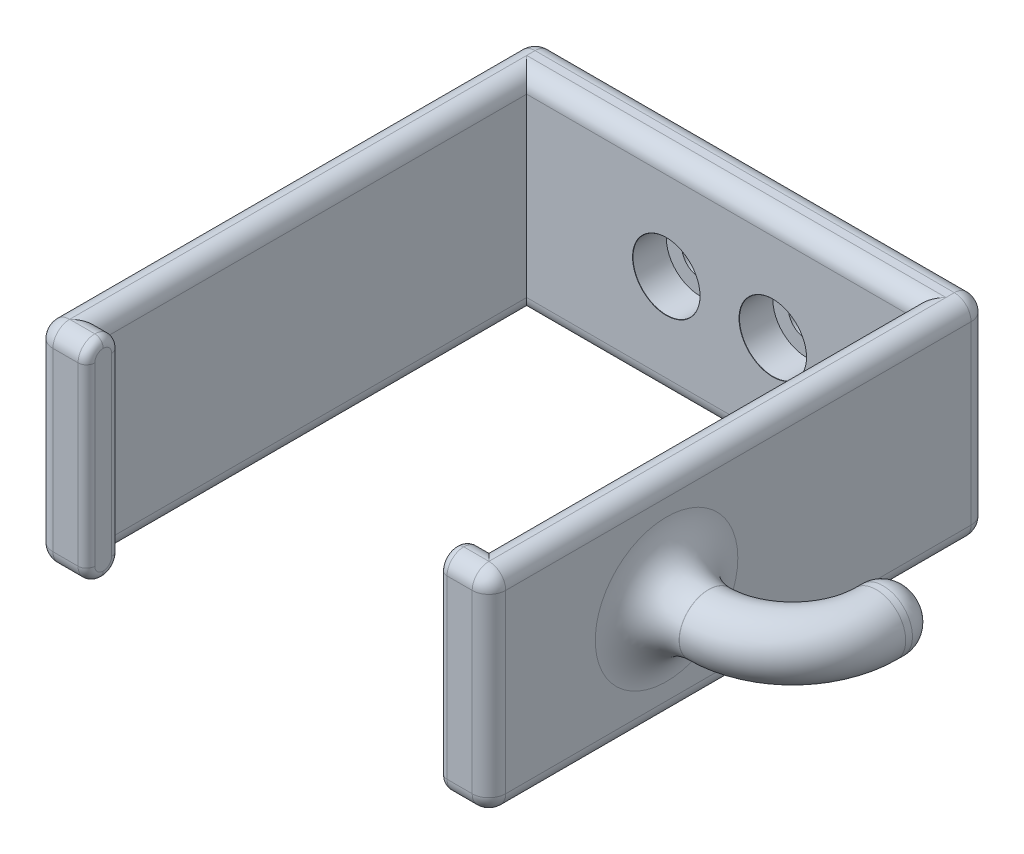
from build123d import *

# Parameters (mm, degrees)
BOSS_EXTRUDE1_DEPTH           = 25
FILLET1_R                     = 1
CBORE_FOR_M4_SHCS1_AT_2_COUNT = 2
CBORE_FOR_M4_SHCS1_AT_2_PITCH = 12.7
FILLET2_R                     = 2
SKETCH4_R                     = 3.5
FILLET3_R                     = 5
FILLET4_R                     = 3


with BuildPart() as part:
    # Sketch1 → Boss-Extrude1 (new body)
    with BuildSketch(Plane(origin=(0, 0, 0), x_dir=(1, 0, 0), z_dir=(0, 1, 0))):
        Polygon((18, -1.724489796), (18, -52.224489796), (16, -52.224489796), (16, -56.224489796), (18, -56.224489796), (22, -56.224489796), (22, 3.275510204), (-32, 3.275510204), (-32, -56.224489796), (-28, -56.224489796), (-26, -56.224489796), (-26, -52.224489796), (-28, -52.224489796), (-28, -1.724489796), align=None)
    extrude(amount=BOSS_EXTRUDE1_DEPTH)

    # Fillet1
    fillet1_edges = [part.edges().sort_by_distance(p)[0] for p in [
        (-26, 0, 54.224489796),
        (16, 0, 54.224489796),
        (16, 12.5, 52.224489796),
        (-26, 12.5, 52.224489796),
        (-26, 12.5, 56.224489796),
        (16, 12.5, 56.224489796),
        (-26, 25, 54.224489796),
        (16, 25, 54.224489796),
    ]]
    fillet(fillet1_edges, radius=FILLET1_R)

    # Sketch3 → CBORE for M4 SHCS1 (revolve, cut)
    with BuildSketch(Plane(origin=(1.35, 12.5, 1.724489796), x_dir=(0, -1, 0), z_dir=(1, 0, 0))):
        Polygon((0, 0), (0, 5), (2.15, 5), (2.15, 4), (4, 4), (4, 0.025), (4.025, 0), align=None)
    cbore_for_m4_shcs1 = revolve(axis=Axis((1.35, 12.5, 8.074489796), (0, 0, -1)), mode=Mode.SUBTRACT)

    # CBORE for M4 SHCS1 at 2: CBORE for M4 SHCS1 ×2
    with Locations(*[(-i * CBORE_FOR_M4_SHCS1_AT_2_PITCH, 0, 0) for i in range(1, CBORE_FOR_M4_SHCS1_AT_2_COUNT)]):
        add(cbore_for_m4_shcs1, mode=Mode.SUBTRACT)

    # Fillet2
    # the kernel refuses this fillet: 2 mm, written as the material it takes off along each edge
    with BuildSketch(Plane(origin=(16, 23, 54.224489796), x_dir=(0, 1, 0), z_dir=(0, 0, 1))) as fillet2_piece_1:
        with BuildLine():
            CenterArc((1, -1), 1, 0, 90)
            Line((2, -1), (2, 0))
            Line((2, 0), (1, 0))
        make_face()
    revolve(axis=Axis((16, 23, 54.224489796), (-1, 0, 0)), revolution_arc=90, mode=Mode.SUBTRACT)
    with BuildSketch(Plane(origin=(16, 23, 54.224489796), x_dir=(0, 0, 1), z_dir=(0, -1, 0))) as fillet2_piece_2:
        with BuildLine():
            CenterArc((1, -1), 1, 0, 90)
            Line((2, -1), (2, 0))
            Line((2, 0), (1, 0))
        make_face()
    revolve(axis=Axis((16, 23, 54.224489796), (-1, 0, 0)), revolution_arc=90, mode=Mode.SUBTRACT)
    with BuildSketch(Plane(origin=(-26, 23, 54.224489796), x_dir=(0, 1, 0), z_dir=(0, 0, -1))) as fillet2_piece_3:
        with BuildLine():
            CenterArc((1, -1), 1, 0, 90)
            Line((2, -1), (2, 0))
            Line((2, 0), (1, 0))
        make_face()
    revolve(axis=Axis((-26, 23, 54.224489796), (1, 0, 0)), revolution_arc=90, mode=Mode.SUBTRACT)
    with BuildSketch(Plane(origin=(-26, 23, 54.224489796), x_dir=(0, 0, -1), z_dir=(0, -1, 0))) as fillet2_piece_4:
        with BuildLine():
            CenterArc((1, -1), 1, 0, 90)
            Line((2, -1), (2, 0))
            Line((2, 0), (1, 0))
        make_face()
    revolve(axis=Axis((-26, 23, 54.224489796), (1, 0, 0)), revolution_arc=90, mode=Mode.SUBTRACT)
    with BuildSketch(Plane(origin=(16, 2, 54.224489796), x_dir=(0, -1, 0), z_dir=(0, 0, -1))) as fillet2_piece_5:
        with BuildLine():
            CenterArc((1, -1), 1, 0, 90)
            Line((2, -1), (2, 0))
            Line((2, 0), (1, 0))
        make_face()
    revolve(axis=Axis((16, 2, 54.224489796), (-1, 0, 0)), revolution_arc=90, mode=Mode.SUBTRACT)
    with BuildSketch(Plane(origin=(16, 2, 54.224489796), x_dir=(0, 0, -1), z_dir=(0, 1, 0))) as fillet2_piece_6:
        with BuildLine():
            CenterArc((1, -1), 1, 0, 90)
            Line((2, -1), (2, 0))
            Line((2, 0), (1, 0))
        make_face()
    revolve(axis=Axis((16, 2, 54.224489796), (-1, 0, 0)), revolution_arc=90, mode=Mode.SUBTRACT)
    with BuildSketch(Plane(origin=(-26, 2, 54.224489796), x_dir=(0, -1, 0), z_dir=(0, 0, 1))) as fillet2_piece_7:
        with BuildLine():
            CenterArc((1, -1), 1, 0, 90)
            Line((2, -1), (2, 0))
            Line((2, 0), (1, 0))
        make_face()
    revolve(axis=Axis((-26, 2, 54.224489796), (1, 0, 0)), revolution_arc=90, mode=Mode.SUBTRACT)
    with BuildSketch(Plane(origin=(-26, 2, 54.224489796), x_dir=(0, 0, 1), z_dir=(0, 1, 0))) as fillet2_piece_8:
        with BuildLine():
            CenterArc((1, -1), 1, 0, 90)
            Line((2, -1), (2, 0))
            Line((2, 0), (1, 0))
        make_face()
    revolve(axis=Axis((-26, 2, 54.224489796), (1, 0, 0)), revolution_arc=90, mode=Mode.SUBTRACT)
    with BuildSketch(Plane(origin=(20, 2, -1.275510204), x_dir=(0, -1, 0), z_dir=(0, 0, -1))) as fillet2_piece_9_section:
        Polygon((0, 0), (FILLET2_R, 0), (FILLET2_R, -FILLET2_R), (0, -FILLET2_R), align=None)
    fillet2_piece_9 = extrude(amount=FILLET2_R, mode=Mode.PRIVATE)
    fillet2_piece_9 = fillet2_piece_9 - Plane(origin=(20, 2, -1.275510204), x_dir=(-0.7071067811865475, 0.7071067811865475, 0), z_dir=(0, 0, -1)) * Sphere(FILLET2_R, mode=Mode.PRIVATE)
    add(fillet2_piece_9, mode=Mode.SUBTRACT)
    with BuildSketch(Plane(origin=(-30, 2, -1.275510204), x_dir=(-1, 0, 0), z_dir=(0, 0, -1))) as fillet2_piece_10_section:
        Polygon((0, 0), (FILLET2_R, 0), (FILLET2_R, -FILLET2_R), (0, -FILLET2_R), align=None)
    fillet2_piece_10 = extrude(amount=FILLET2_R, mode=Mode.PRIVATE)
    fillet2_piece_10 = fillet2_piece_10 - Plane(origin=(-30, 2, -1.275510204), x_dir=(0.7071067811865475, 0.7071067811865475, 0), z_dir=(0, 0, -1)) * Sphere(FILLET2_R, mode=Mode.PRIVATE)
    add(fillet2_piece_10, mode=Mode.SUBTRACT)
    with BuildSketch(Plane(origin=(-30, 2, 54.224489796), x_dir=(0, 0, 1), z_dir=(-1, 0, 0))) as fillet2_piece_11_section:
        Polygon((0, 0), (FILLET2_R, 0), (FILLET2_R, -FILLET2_R), (0, -FILLET2_R), align=None)
    fillet2_piece_11 = extrude(amount=FILLET2_R, mode=Mode.PRIVATE)
    fillet2_piece_11 = fillet2_piece_11 - Plane(origin=(-30, 2, 54.224489796), x_dir=(1.25607396694702e-15, 0.7071067811865475, -0.7071067811865475), z_dir=(-1, 0, 0)) * Sphere(FILLET2_R, mode=Mode.PRIVATE)
    add(fillet2_piece_11, mode=Mode.SUBTRACT)
    with BuildSketch(Plane(origin=(20, 2, 54.224489796), x_dir=(0, -1, 0), z_dir=(0, 0, 1))) as fillet2_piece_12_section:
        Polygon((0, 0), (FILLET2_R, 0), (FILLET2_R, FILLET2_R), (0, FILLET2_R), align=None)
    fillet2_piece_12 = extrude(amount=FILLET2_R, mode=Mode.PRIVATE)
    fillet2_piece_12 = fillet2_piece_12 - Plane(origin=(20, 2, 54.224489796), x_dir=(-0.7071067811865475, 0.7071067811865475, 0), z_dir=(0, 0, 1)) * Sphere(FILLET2_R, mode=Mode.PRIVATE)
    add(fillet2_piece_12, mode=Mode.SUBTRACT)
    with BuildSketch(Plane(origin=(-30, 23, 54.224489796), x_dir=(-1, 0, 0), z_dir=(0, 1, 0))) as fillet2_piece_13_section:
        Polygon((0, 0), (FILLET2_R, 0), (FILLET2_R, FILLET2_R), (0, FILLET2_R), align=None)
    fillet2_piece_13 = extrude(amount=FILLET2_R, mode=Mode.PRIVATE)
    fillet2_piece_13 = fillet2_piece_13 - Plane(origin=(-30, 23, 54.224489796), x_dir=(0.707106781186548, 0, -0.707106781186547), z_dir=(0, 1, 0)) * Sphere(FILLET2_R, mode=Mode.PRIVATE)
    add(fillet2_piece_13, mode=Mode.SUBTRACT)
    with BuildSketch(Plane(origin=(20, 23, -1.275510204), x_dir=(0, 0, -1), z_dir=(0, 1, 0))) as fillet2_piece_14_section:
        Polygon((0, 0), (FILLET2_R, 0), (FILLET2_R, -FILLET2_R), (0, -FILLET2_R), align=None)
    fillet2_piece_14 = extrude(amount=FILLET2_R, mode=Mode.PRIVATE)
    fillet2_piece_14 = fillet2_piece_14 - Plane(origin=(20, 23, -1.275510204), x_dir=(-0.7071067811865475, 0, 0.7071067811865477), z_dir=(0, 1, 0)) * Sphere(FILLET2_R, mode=Mode.PRIVATE)
    add(fillet2_piece_14, mode=Mode.SUBTRACT)
    with BuildSketch(Plane(origin=(-30, 23, -1.275510204), x_dir=(0, 0, -1), z_dir=(0, 1, 0))) as fillet2_piece_15_section:
        Polygon((0, 0), (FILLET2_R, 0), (FILLET2_R, FILLET2_R), (0, FILLET2_R), align=None)
    fillet2_piece_15 = extrude(amount=FILLET2_R, mode=Mode.PRIVATE)
    fillet2_piece_15 = fillet2_piece_15 - Plane(origin=(-30, 23, -1.275510204), x_dir=(0.7071067811865476, 0, 0.7071067811865475), z_dir=(0, 1, 0)) * Sphere(FILLET2_R, mode=Mode.PRIVATE)
    add(fillet2_piece_15, mode=Mode.SUBTRACT)
    with BuildSketch(Plane(origin=(20, 23, 54.224489796), x_dir=(0, 0, 1), z_dir=(0, 1, 0))) as fillet2_piece_16_section:
        Polygon((0, 0), (FILLET2_R, 0), (FILLET2_R, FILLET2_R), (0, FILLET2_R), align=None)
    fillet2_piece_16 = extrude(amount=FILLET2_R, mode=Mode.PRIVATE)
    fillet2_piece_16 = fillet2_piece_16 - Plane(origin=(20, 23, 54.224489796), x_dir=(-0.7071067811865464, 0, -0.7071067811865487), z_dir=(0, 1, 0)) * Sphere(FILLET2_R, mode=Mode.PRIVATE)
    add(fillet2_piece_16, mode=Mode.SUBTRACT)
    with BuildSketch(Plane(origin=(20, 0, -3.275510204), x_dir=(0, 1, 0), z_dir=(-1, 0, 0)), Plane(origin=(20, 25, -3.275510204), x_dir=(0, 0, 1), z_dir=(-1, 0, 0))) as fillet2_piece_17:
        with BuildLine():
            CenterArc((FILLET2_R, -FILLET2_R), FILLET2_R, 90, 90)
            Line((0, -FILLET2_R), (0, 0))
            Line((0, 0), (FILLET2_R, 0))
        make_face()
    extrude(amount=50, mode=Mode.SUBTRACT)
    with BuildSketch(Plane(origin=(-30, 0, 56.224489796), x_dir=(0, 1, 0), z_dir=(1, 0, 0)), Plane(origin=(16, 0, 56.224489796), x_dir=(0, 1, 0), z_dir=(1, 0, 0))) as fillet2_piece_18:
        with BuildLine():
            CenterArc((FILLET2_R, -FILLET2_R), FILLET2_R, 90, 90)
            Line((0, -FILLET2_R), (0, 0))
            Line((0, 0), (FILLET2_R, 0))
        make_face()
    extrude(amount=4, mode=Mode.SUBTRACT)
    with BuildSketch(Plane(origin=(-26, 0, 52.224489796), x_dir=(0, 1, 0), z_dir=(-1, 0, 0)), Plane(origin=(18, 0, 52.224489796), x_dir=(0, 1, 0), z_dir=(-1, 0, 0)), Plane(origin=(-26, 25, 52.224489796), x_dir=(0, 0, 1), z_dir=(-1, 0, 0)), Plane(origin=(18, 25, 52.224489796), x_dir=(0, 0, 1), z_dir=(-1, 0, 0))) as fillet2_piece_19:
        with BuildLine():
            CenterArc((FILLET2_R, -FILLET2_R), FILLET2_R, 90, 90)
            Line((0, -FILLET2_R), (0, 0))
            Line((0, 0), (FILLET2_R, 0))
        make_face()
    extrude(amount=2, mode=Mode.SUBTRACT)
    with BuildSketch(Plane(origin=(-28, 0, 52.224489796), x_dir=(0, 1, 0), z_dir=(0, 0, -1)), Plane(origin=(18, 0, 1.724489796), x_dir=(0, 1, 0), z_dir=(0, 0, 1)), Plane(origin=(18, 25, 1.724489796), x_dir=(1, 0, 0), z_dir=(0, 0, 1)), Plane(origin=(-28, 25, 52.224489796), x_dir=(-1, 0, 0), z_dir=(0, 0, -1))) as fillet2_piece_20:
        with BuildLine():
            CenterArc((FILLET2_R, -FILLET2_R), FILLET2_R, 90, 90)
            Line((0, -FILLET2_R), (0, 0))
            Line((0, 0), (FILLET2_R, 0))
        make_face()
    extrude(amount=50.5, mode=Mode.SUBTRACT)
    with BuildSketch(Plane(origin=(-28, 0, 1.724489796), x_dir=(0, 1, 0), z_dir=(1, 0, 0)), Plane(origin=(-28, 25, 1.724489796), x_dir=(0, 0, -1), z_dir=(1, 0, 0))) as fillet2_piece_21:
        with BuildLine():
            CenterArc((FILLET2_R, -FILLET2_R), FILLET2_R, 90, 90)
            Line((0, -FILLET2_R), (0, 0))
            Line((0, 0), (FILLET2_R, 0))
        make_face()
    extrude(amount=46, mode=Mode.SUBTRACT)
    with BuildSketch(Plane(origin=(-26, 25, 56.224489796), x_dir=(0, 0, -1), z_dir=(-1, 0, 0)), Plane(origin=(20, 25, 56.224489796), x_dir=(0, 0, -1), z_dir=(-1, 0, 0))) as fillet2_piece_22:
        with BuildLine():
            CenterArc((FILLET2_R, FILLET2_R), FILLET2_R, 180, 90)
            Line((0, FILLET2_R), (0, 0))
            Line((0, 0), (FILLET2_R, 0))
        make_face()
    extrude(amount=4, mode=Mode.SUBTRACT)
    with BuildSketch(Plane(origin=(-32, 2, -3.275510204), x_dir=(1, 0, 0), z_dir=(0, 1, 0)), Plane(origin=(-32, 2, 56.224489796), x_dir=(0, 0, -1), z_dir=(0, 1, 0)), Plane(origin=(22, 2, 56.224489796), x_dir=(-1, 0, 0), z_dir=(0, 1, 0)), Plane(origin=(22, 2, -3.275510204), x_dir=(0, 0, 1), z_dir=(0, 1, 0))) as fillet2_piece_23:
        with BuildLine():
            CenterArc((FILLET2_R, -FILLET2_R), FILLET2_R, 90, 90)
            Line((0, -FILLET2_R), (0, 0))
            Line((0, 0), (FILLET2_R, 0))
        make_face()
    extrude(amount=21, mode=Mode.SUBTRACT)
    with BuildSketch(Plane(origin=(-32, 25, -1.275510204), x_dir=(1, 0, 0), z_dir=(0, 0, 1)), Plane(origin=(-32, 0, -1.275510204), x_dir=(0, 1, 0), z_dir=(0, 0, 1)), Plane(origin=(22, 25, 54.224489796), x_dir=(-1, 0, 0), z_dir=(0, 0, -1)), Plane(origin=(22, 0, 54.224489796), x_dir=(0, 1, 0), z_dir=(0, 0, -1))) as fillet2_piece_24:
        with BuildLine():
            CenterArc((FILLET2_R, -FILLET2_R), FILLET2_R, 90, 90)
            Line((0, -FILLET2_R), (0, 0))
            Line((0, 0), (FILLET2_R, 0))
        make_face()
    extrude(amount=55.5, mode=Mode.SUBTRACT)
    with BuildSketch(Plane(origin=(-28, 0, 57.224489796), x_dir=(0, 1, 0), z_dir=(0, 0, -1))) as fillet2_piece_25a_section:
        with BuildLine():
            CenterArc((FILLET2_R, -FILLET2_R), FILLET2_R, 90, 90)
            Line((0, -FILLET2_R), (0, 0))
            Line((0, 0), (FILLET2_R, 0))
        make_face()
    fillet2_piece_25a = extrude(amount=55.5, mode=Mode.PRIVATE)
    fillet2_piece_25a = split(fillet2_piece_25a, bisect_by=Plane(origin=(-28.452790229, 0.452790229, 52.224489796), z_dir=(0, 0, 1)), keep=Keep.TOP, mode=Mode.PRIVATE)
    with BuildSketch(Plane(origin=(-26, 0, 52.224489796), x_dir=(0, 1, 0), z_dir=(-1, 0, 0))) as fillet2_piece_25b_section:
        with BuildLine():
            CenterArc((FILLET2_R, -FILLET2_R), FILLET2_R, 90, 90)
            Line((0, -FILLET2_R), (0, 0))
            Line((0, 0), (FILLET2_R, 0))
        make_face()
    fillet2_piece_25b = extrude(amount=7, mode=Mode.PRIVATE)
    fillet2_piece_25b = split(fillet2_piece_25b, bisect_by=Plane(origin=(-28, 0.452790229, 52.677280024), z_dir=(-1, 0, 0)), keep=Keep.TOP, mode=Mode.PRIVATE)
    fillet2_piece_25 = fillet2_piece_25a & fillet2_piece_25b
    add(fillet2_piece_25, mode=Mode.SUBTRACT)
    with BuildSketch(Plane(origin=(-33, 0, 1.724489796), x_dir=(0, 1, 0), z_dir=(1, 0, 0))) as fillet2_piece_26a_section:
        with BuildLine():
            CenterArc((FILLET2_R, -FILLET2_R), FILLET2_R, 90, 90)
            Line((0, -FILLET2_R), (0, 0))
            Line((0, 0), (FILLET2_R, 0))
        make_face()
    fillet2_piece_26a = extrude(amount=51, mode=Mode.PRIVATE)
    fillet2_piece_26a = split(fillet2_piece_26a, bisect_by=Plane(origin=(-28, 0.452790229, 1.271699567), z_dir=(-1, 0, 0)), keep=Keep.TOP, mode=Mode.PRIVATE)
    with BuildSketch(Plane(origin=(-28, 0, 52.224489796), x_dir=(0, 1, 0), z_dir=(0, 0, -1))) as fillet2_piece_26b_section:
        with BuildLine():
            CenterArc((FILLET2_R, -FILLET2_R), FILLET2_R, 90, 90)
            Line((0, -FILLET2_R), (0, 0))
            Line((0, 0), (FILLET2_R, 0))
        make_face()
    fillet2_piece_26b = extrude(amount=55.5, mode=Mode.PRIVATE)
    fillet2_piece_26b = split(fillet2_piece_26b, bisect_by=Plane(origin=(-28.452790229, 0.452790229, 1.724489796), z_dir=(0, 0, -1)), keep=Keep.TOP, mode=Mode.PRIVATE)
    fillet2_piece_26 = fillet2_piece_26a & fillet2_piece_26b
    add(fillet2_piece_26, mode=Mode.SUBTRACT)
    with BuildSketch(Plane(origin=(18, 0, -3.275510204), x_dir=(0, 1, 0), z_dir=(0, 0, 1))) as fillet2_piece_27a_section:
        with BuildLine():
            CenterArc((FILLET2_R, -FILLET2_R), FILLET2_R, 90, 90)
            Line((0, -FILLET2_R), (0, 0))
            Line((0, 0), (FILLET2_R, 0))
        make_face()
    fillet2_piece_27a = extrude(amount=55.5, mode=Mode.PRIVATE)
    fillet2_piece_27a = split(fillet2_piece_27a, bisect_by=Plane(origin=(18.452790229, 0.452790229, 1.724489796), z_dir=(0, 0, -1)), keep=Keep.TOP, mode=Mode.PRIVATE)
    with BuildSketch(Plane(origin=(-28, 0, 1.724489796), x_dir=(0, 1, 0), z_dir=(1, 0, 0))) as fillet2_piece_27b_section:
        with BuildLine():
            CenterArc((FILLET2_R, -FILLET2_R), FILLET2_R, 90, 90)
            Line((0, -FILLET2_R), (0, 0))
            Line((0, 0), (FILLET2_R, 0))
        make_face()
    fillet2_piece_27b = extrude(amount=51, mode=Mode.PRIVATE)
    fillet2_piece_27b = split(fillet2_piece_27b, bisect_by=Plane(origin=(18, 0.452790229, 1.271699567), z_dir=(1, 0, 0)), keep=Keep.TOP, mode=Mode.PRIVATE)
    fillet2_piece_27 = fillet2_piece_27a & fillet2_piece_27b
    add(fillet2_piece_27, mode=Mode.SUBTRACT)
    with BuildSketch(Plane(origin=(23, 0, 52.224489796), x_dir=(0, 1, 0), z_dir=(-1, 0, 0))) as fillet2_piece_28a_section:
        with BuildLine():
            CenterArc((FILLET2_R, -FILLET2_R), FILLET2_R, 90, 90)
            Line((0, -FILLET2_R), (0, 0))
            Line((0, 0), (FILLET2_R, 0))
        make_face()
    fillet2_piece_28a = extrude(amount=7, mode=Mode.PRIVATE)
    fillet2_piece_28a = split(fillet2_piece_28a, bisect_by=Plane(origin=(18, 0.452790229, 52.677280024), z_dir=(1, 0, 0)), keep=Keep.TOP, mode=Mode.PRIVATE)
    with BuildSketch(Plane(origin=(18, 0, 1.724489796), x_dir=(0, 1, 0), z_dir=(0, 0, 1))) as fillet2_piece_28b_section:
        with BuildLine():
            CenterArc((FILLET2_R, -FILLET2_R), FILLET2_R, 90, 90)
            Line((0, -FILLET2_R), (0, 0))
            Line((0, 0), (FILLET2_R, 0))
        make_face()
    fillet2_piece_28b = extrude(amount=55.5, mode=Mode.PRIVATE)
    fillet2_piece_28b = split(fillet2_piece_28b, bisect_by=Plane(origin=(18.452790229, 0.452790229, 52.224489796), z_dir=(0, 0, 1)), keep=Keep.TOP, mode=Mode.PRIVATE)
    fillet2_piece_28 = fillet2_piece_28a & fillet2_piece_28b
    add(fillet2_piece_28, mode=Mode.SUBTRACT)
    with BuildSketch(Plane(origin=(18, 25, -3.275510204), x_dir=(1, 0, 0), z_dir=(0, 0, 1))) as fillet2_piece_29a_section:
        with BuildLine():
            CenterArc((FILLET2_R, -FILLET2_R), FILLET2_R, 90, 90)
            Line((0, -FILLET2_R), (0, 0))
            Line((0, 0), (FILLET2_R, 0))
        make_face()
    fillet2_piece_29a = extrude(amount=55.5, mode=Mode.PRIVATE)
    fillet2_piece_29a = split(fillet2_piece_29a, bisect_by=Plane(origin=(18.452790229, 24.547209771, 1.724489796), z_dir=(0, 0, -1)), keep=Keep.TOP, mode=Mode.PRIVATE)
    with BuildSketch(Plane(origin=(-28, 25, 1.724489796), x_dir=(0, 0, -1), z_dir=(1, 0, 0))) as fillet2_piece_29b_section:
        with BuildLine():
            CenterArc((FILLET2_R, -FILLET2_R), FILLET2_R, 90, 90)
            Line((0, -FILLET2_R), (0, 0))
            Line((0, 0), (FILLET2_R, 0))
        make_face()
    fillet2_piece_29b = extrude(amount=51, mode=Mode.PRIVATE)
    fillet2_piece_29b = split(fillet2_piece_29b, bisect_by=Plane(origin=(18, 24.547209771, 1.271699567), z_dir=(1, 0, 0)), keep=Keep.TOP, mode=Mode.PRIVATE)
    fillet2_piece_29 = fillet2_piece_29a & fillet2_piece_29b
    add(fillet2_piece_29, mode=Mode.SUBTRACT)
    with BuildSketch(Plane(origin=(23, 25, 52.224489796), x_dir=(0, 0, 1), z_dir=(-1, 0, 0))) as fillet2_piece_30a_section:
        with BuildLine():
            CenterArc((FILLET2_R, -FILLET2_R), FILLET2_R, 90, 90)
            Line((0, -FILLET2_R), (0, 0))
            Line((0, 0), (FILLET2_R, 0))
        make_face()
    fillet2_piece_30a = extrude(amount=7, mode=Mode.PRIVATE)
    fillet2_piece_30a = split(fillet2_piece_30a, bisect_by=Plane(origin=(18, 24.547209771, 52.677280024), z_dir=(1, 0, 0)), keep=Keep.TOP, mode=Mode.PRIVATE)
    with BuildSketch(Plane(origin=(18, 25, 1.724489796), x_dir=(1, 0, 0), z_dir=(0, 0, 1))) as fillet2_piece_30b_section:
        with BuildLine():
            CenterArc((FILLET2_R, -FILLET2_R), FILLET2_R, 90, 90)
            Line((0, -FILLET2_R), (0, 0))
            Line((0, 0), (FILLET2_R, 0))
        make_face()
    fillet2_piece_30b = extrude(amount=55.5, mode=Mode.PRIVATE)
    fillet2_piece_30b = split(fillet2_piece_30b, bisect_by=Plane(origin=(18.452790229, 24.547209771, 52.224489796), z_dir=(0, 0, 1)), keep=Keep.TOP, mode=Mode.PRIVATE)
    fillet2_piece_30 = fillet2_piece_30a & fillet2_piece_30b
    add(fillet2_piece_30, mode=Mode.SUBTRACT)
    with BuildSketch(Plane(origin=(-33, 25, 1.724489796), x_dir=(0, 0, -1), z_dir=(1, 0, 0))) as fillet2_piece_31a_section:
        with BuildLine():
            CenterArc((FILLET2_R, -FILLET2_R), FILLET2_R, 90, 90)
            Line((0, -FILLET2_R), (0, 0))
            Line((0, 0), (FILLET2_R, 0))
        make_face()
    fillet2_piece_31a = extrude(amount=51, mode=Mode.PRIVATE)
    fillet2_piece_31a = split(fillet2_piece_31a, bisect_by=Plane(origin=(-28, 24.547209771, 1.271699567), z_dir=(-1, 0, 0)), keep=Keep.TOP, mode=Mode.PRIVATE)
    with BuildSketch(Plane(origin=(-28, 25, 52.224489796), x_dir=(-1, 0, 0), z_dir=(0, 0, -1))) as fillet2_piece_31b_section:
        with BuildLine():
            CenterArc((FILLET2_R, -FILLET2_R), FILLET2_R, 90, 90)
            Line((0, -FILLET2_R), (0, 0))
            Line((0, 0), (FILLET2_R, 0))
        make_face()
    fillet2_piece_31b = extrude(amount=55.5, mode=Mode.PRIVATE)
    fillet2_piece_31b = split(fillet2_piece_31b, bisect_by=Plane(origin=(-28.452790229, 24.547209771, 1.724489796), z_dir=(0, 0, -1)), keep=Keep.TOP, mode=Mode.PRIVATE)
    fillet2_piece_31 = fillet2_piece_31a & fillet2_piece_31b
    add(fillet2_piece_31, mode=Mode.SUBTRACT)
    with BuildSketch(Plane(origin=(-28, 25, 57.224489796), x_dir=(-1, 0, 0), z_dir=(0, 0, -1))) as fillet2_piece_32a_section:
        with BuildLine():
            CenterArc((FILLET2_R, -FILLET2_R), FILLET2_R, 90, 90)
            Line((0, -FILLET2_R), (0, 0))
            Line((0, 0), (FILLET2_R, 0))
        make_face()
    fillet2_piece_32a = extrude(amount=55.5, mode=Mode.PRIVATE)
    fillet2_piece_32a = split(fillet2_piece_32a, bisect_by=Plane(origin=(-28.452790229, 24.547209771, 52.224489796), z_dir=(0, 0, 1)), keep=Keep.TOP, mode=Mode.PRIVATE)
    with BuildSketch(Plane(origin=(-26, 25, 52.224489796), x_dir=(0, 0, 1), z_dir=(-1, 0, 0))) as fillet2_piece_32b_section:
        with BuildLine():
            CenterArc((FILLET2_R, -FILLET2_R), FILLET2_R, 90, 90)
            Line((0, -FILLET2_R), (0, 0))
            Line((0, 0), (FILLET2_R, 0))
        make_face()
    fillet2_piece_32b = extrude(amount=7, mode=Mode.PRIVATE)
    fillet2_piece_32b = split(fillet2_piece_32b, bisect_by=Plane(origin=(-28, 24.547209771, 52.677280024), z_dir=(-1, 0, 0)), keep=Keep.TOP, mode=Mode.PRIVATE)
    fillet2_piece_32 = fillet2_piece_32a & fillet2_piece_32b
    add(fillet2_piece_32, mode=Mode.SUBTRACT)

    # Sweep2: sweep along a path in Sketch6
    with BuildLine(Plane(origin=(0, 12.5, 0), x_dir=(1, 0, 0), z_dir=(0, 1, 0))) as sweep2_path:
        Line((22, -35.042835549), (27.019958302, -35.042835549))
        ThreePointArc((27.019958302, -35.042835549), (34.091026114, -32.11390336), (37.019958302, -25.042835549))
        Line((37.019958302, -25.042835549), (37.019958302, -21.236981576))
    # Sketch4 → Sweep2 (sweep)
    with BuildSketch(Plane(origin=(22, 0, 0), x_dir=(0, 0, -1), z_dir=(1, 0, 0))):
        with Locations((-35.042835549, 12.5)):
            Circle(SKETCH4_R)
    sweep(path=sweep2_path.line)

    # Fillet3
    fillet3_edges = [part.edges().sort_by_distance(p)[0] for p in [
        (22, 12.5, 38.542835549),
    ]]
    fillet(fillet3_edges, radius=FILLET3_R)

    # Fillet4
    fillet4_edges = [part.edges().sort_by_distance(p)[0] for p in [
        (40.519958302, 12.5, 21.236981576),
    ]]
    fillet(fillet4_edges, radius=FILLET4_R)


solid = part.part
